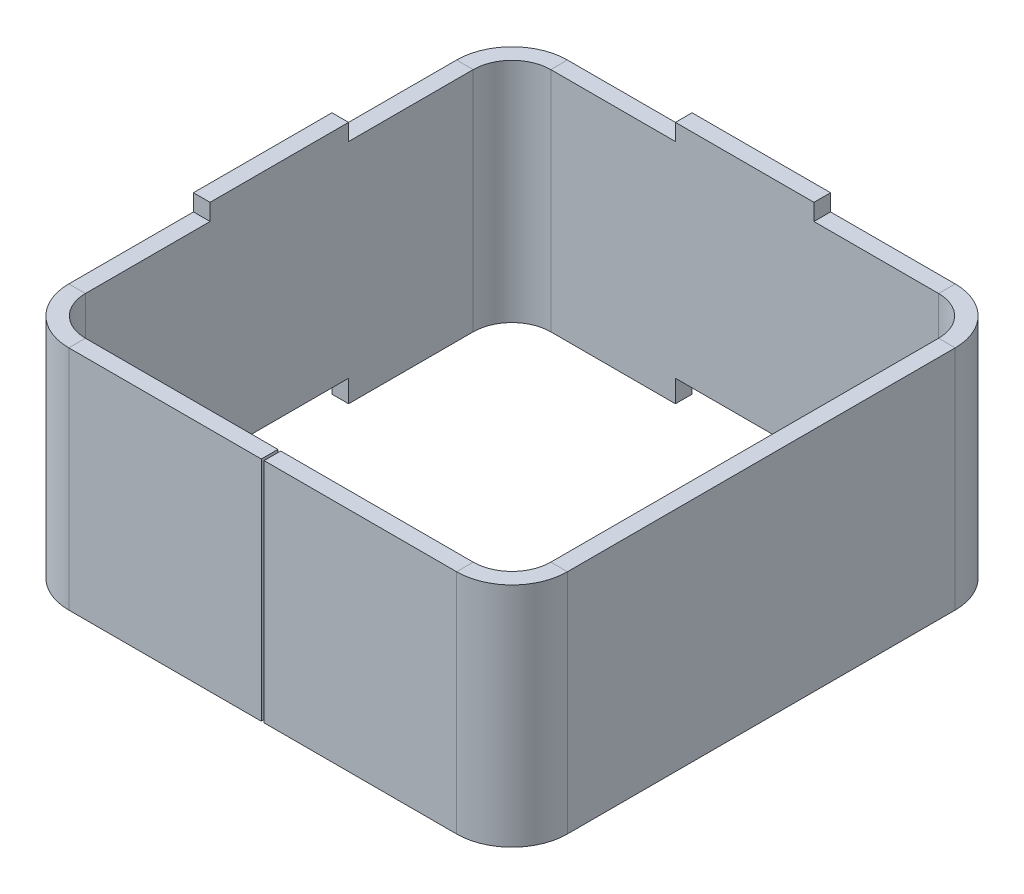
from build123d import *

# Parameters (mm, degrees)
BASE_FLANGE1_DEPTH  = 41
SKETCH8_W           = 25
SKETCH8_H           = 8
CUT_EXTRUDE1_DEPTH  = 5
SKETCH9_W           = 25
SKETCH9_H           = 8
CUT_EXTRUDE2_DEPTH  = 5
SKETCH10_W          = 25
SKETCH10_H          = 6
BOSS_EXTRUDE1_DEPTH = 3
SKETCH11_W          = 25
SKETCH11_H          = 6
BOSS_EXTRUDE2_DEPTH = 3


# Read off the part's stored shape, not the designer's step: Base-Flange1
with BuildPart() as part:
    # Base-Flange1 outline → Base-Flange1 (new body)
    with BuildSketch(Plane(origin=(0, 0, 0), x_dir=(1, 0, 0), z_dir=(0, 1, 0))):
        with BuildLine():
            Line((7, -3), (41.75, -3))
            Line((41.75, -3), (41.75, 0))
            Line((41.75, 0), (7, 0))
            ThreePointArc((7, 0), (2.050252532, 2.050252532), (0, 7))
            Line((0, 7), (0, 77))
            ThreePointArc((0, 77), (2.050252532, 81.949747468), (7, 84))
            Line((7, 84), (77, 84))
            ThreePointArc((77, 84), (81.949747468, 81.949747468), (84, 77))
            Line((84, 77), (84, 7))
            ThreePointArc((84, 7), (81.949747468, 2.050252532), (77, 0))
            Line((77, 0), (42.25, 0))
            Line((42.25, 0), (42.25, -3))
            Line((42.25, -3), (77, -3))
            ThreePointArc((77, -3), (84.071067812, -0.071067812), (87, 7))
            Line((87, 7), (87, 77))
            ThreePointArc((87, 77), (84.071067812, 84.071067812), (77, 87))
            Line((77, 87), (7, 87))
            ThreePointArc((7, 87), (-0.071067812, 84.071067812), (-3, 77))
            Line((-3, 77), (-3, 7))
            ThreePointArc((-3, 7), (-0.071067812, -0.071067812), (7, -3))
        make_face()
    extrude(amount=BASE_FLANGE1_DEPTH)

    # Sketch8 → Cut-Extrude1 (cut)
    with BuildSketch(Plane(origin=(0, 0, -87), x_dir=(-1, 0, 0), z_dir=(0, 0, -1))):
        with Locations((-42, 0)):
            Rectangle(SKETCH8_W, SKETCH8_H)
    extrude(amount=-CUT_EXTRUDE1_DEPTH, mode=Mode.SUBTRACT)

    # Sketch9 → Cut-Extrude2 (cut)
    with BuildSketch(Plane.ZY.offset(3)):
        with Locations((-42, 0)):
            Rectangle(SKETCH9_W, SKETCH9_H)
    extrude(amount=-CUT_EXTRUDE2_DEPTH, mode=Mode.SUBTRACT)

    # Sketch10 → Boss-Extrude1 (add)
    with BuildSketch(Plane(origin=(0, 0, -87), x_dir=(-1, 0, 0), z_dir=(0, 0, -1))):
        with Locations((-42, 41)):
            Rectangle(SKETCH10_W, SKETCH10_H)
    extrude(amount=-BOSS_EXTRUDE1_DEPTH)

    # Sketch11 → Boss-Extrude2 (add)
    with BuildSketch(Plane.ZY.offset(3)):
        with Locations((-42, 41)):
            Rectangle(SKETCH11_W, SKETCH11_H)
    extrude(amount=-BOSS_EXTRUDE2_DEPTH)


solid = part.part
